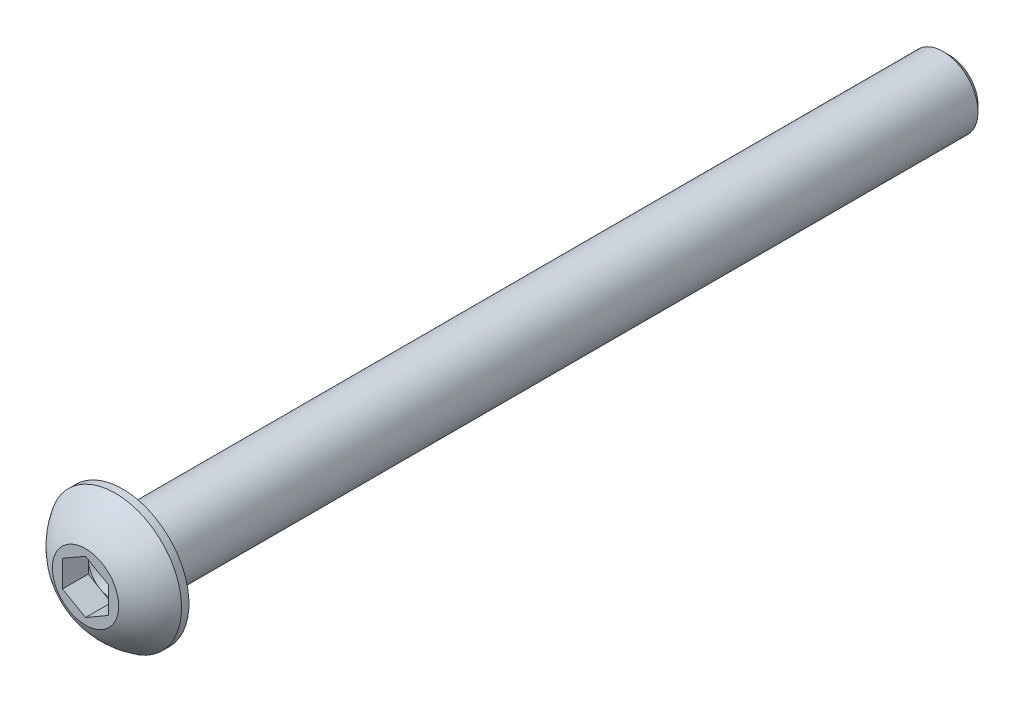
from build123d import *

# Parameters (mm, degrees)
SKETCH2_R           = 2.413
BOSS_EXTRUDE1_DEPTH = 57.15
CUT_EXTRUDE1_DEPTH  = 1.778
CHAMFER1_SIZE       = 0.428942381
FILLET1_R           = 0.381


with BuildPart() as part:
    # Sketch1 → Revolve1 (revolve)
    with BuildSketch(Plane.XZ):
        with BuildLine():
            Line((2.29235, 0), (0, 0))
            Line((0, 0), (0, -2.5654))
            Line((0, -2.5654), (4.5847, -2.5654))
            Line((4.5847, -2.5654), (4.5847, -2.0574))
            ThreePointArc((4.5847, -2.0574), (3.589105441, -0.860923645), (2.29235, 0))
        make_face()
    revolve(axis=Axis((0, 0, 0), (0, 0, -1)))

    # Sketch2 → Boss-Extrude1 (add)
    with BuildSketch(Plane(origin=(0, 0, -2.5654), x_dir=(-1, 0, 0), z_dir=(0, 0, -1))):
        Circle(SKETCH2_R)
    extrude(amount=BOSS_EXTRUDE1_DEPTH)

    # Sketch3 → Cut-Extrude1 (cut)
    with BuildSketch(Plane.XY):
        Polygon((1.5875, -0.916543552), (1.5875, 0.916543552), (0, 1.833087105), (-1.5875, 0.916543552), (-1.5875, -0.916543552), (0, -1.833087105), align=None)
    extrude(amount=-CUT_EXTRUDE1_DEPTH, mode=Mode.SUBTRACT)

    # Sketch4 → Cut-Revolve1 (revolve, cut)
    with BuildSketch(Plane.XZ):
        Polygon((1.5875, -1.778), (0, -1.778), (0, -2.694543552), align=None)
    revolve(axis=Axis((0, 0, -1.778), (0, 0, -1)), mode=Mode.SUBTRACT)

    # Chamfer1
    chamfer1_edges = [part.edges().sort_by_distance(p)[0] for p in [
        (2.413, 0, -59.7154),
    ]]
    chamfer(chamfer1_edges, length=CHAMFER1_SIZE)

    # Fillet1
    fillet1_edges = [part.edges().sort_by_distance(p)[0] for p in [
        (2.413, 0, -2.5654),
    ]]
    fillet(fillet1_edges, radius=FILLET1_R)


solid = part.part
